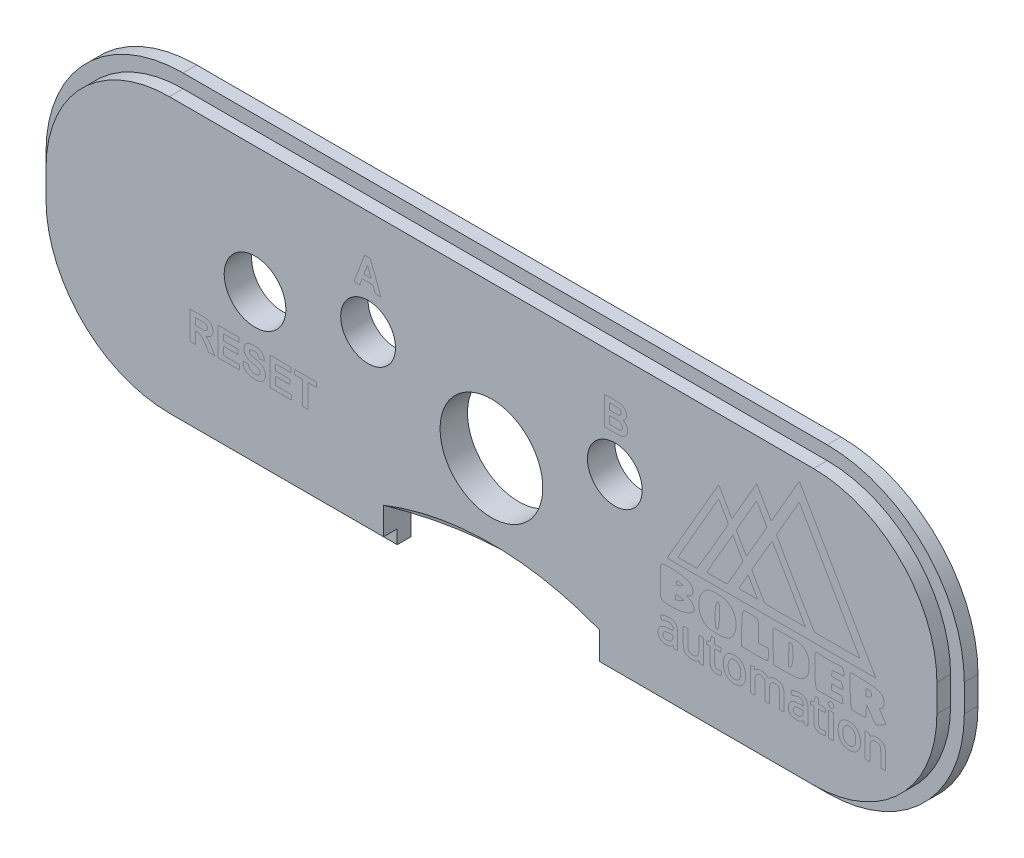
from build123d import *

# Parameters (mm, degrees)
SKETCH1_W           = 67
SKETCH1_H           = 22
BOSS_EXTRUDE1_DEPTH = 1
FILLET1_R           = 10
BOSS_EXTRUDE2_DEPTH = 1
SKETCH3_W           = 15.75
SKETCH3_H           = 6
CUT_EXTRUDE1_DEPTH  = 36.316426773
SKETCH112_R         = 3.75
SKETCH112_R_2       = 2
SKETCH112_R_3       = 2.25
CUT_EXTRUDE2_DEPTH  = 36.316426779


with BuildPart() as part:
    # Sketch1 → Boss-Extrude1 (new body)
    with BuildSketch(Plane.XY):
        Rectangle(SKETCH1_W, SKETCH1_H)
    extrude(amount=BOSS_EXTRUDE1_DEPTH)

    # Fillet1
    fillet1_edges = [part.edges().sort_by_distance(p)[0] for p in [
        (33.5, 11, 0.5),
        (33.5, -11, 0.5),
        (-33.5, -11, 0.5),
        (-33.5, 11, 0.5),
    ]]
    fillet(fillet1_edges, radius=FILLET1_R)

    # Sketch2 → Boss-Extrude2 (add)
    with BuildSketch(Plane.XY.offset(1)):
        with BuildLine():
            Line((32.5, -1), (32.5, 1))
            ThreePointArc((32.5, 1), (29.863961031, 7.363961031), (23.5, 10))
            Line((23.5, 10), (-23.5, 10))
            ThreePointArc((-23.5, 10), (-29.863961031, 7.363961031), (-32.5, 1))
            Line((-32.5, 1), (-32.5, -1))
            ThreePointArc((-32.5, -1), (-29.863961031, -7.363961031), (-23.5, -10))
            Line((-23.5, -10), (23.5, -10))
            ThreePointArc((23.5, -10), (29.863961031, -7.363961031), (32.5, -1))
        make_face()
    extrude(amount=BOSS_EXTRUDE2_DEPTH)

    # Sketch3 → Cut-Extrude1 (cut, through all)
    with BuildSketch(Plane(origin=(0, 0, 0), x_dir=(-1, 0, 0), z_dir=(0, 0, -1))):
        with Locations((0, -11)):
            Rectangle(SKETCH3_W, SKETCH3_H)
    extrude(amount=-CUT_EXTRUDE1_DEPTH, mode=Mode.SUBTRACT)

    # Sketch109 → Cut-Revolve3 (revolve, cut)
    with BuildSketch(Plane.XY.offset(2)):
        with BuildLine():
            ThreePointArc((7.875, -8), (0, -6.5), (-7.875, -8))
            Line((-7.875, -8), (7.875, -8))
        make_face()
    revolve(axis=Axis((7.875, -8, 2), (1, 0, 0)), mode=Mode.SUBTRACT)

    # Sketch112 → Cut-Extrude2 (cut, through all)
    with BuildSketch(Plane(origin=(0, 0, 0), x_dir=(-1, 0, 0), z_dir=(0, 0, -1))):
        with Locations((0, -1.1)):
            Circle(SKETCH112_R)
        with Locations((9, 2.38)):
            Circle(SKETCH112_R_2)
        with Locations((-9, 2.38)):
            Circle(SKETCH112_R_2)
        with Locations((17.25, 0.8)):
            Circle(SKETCH112_R_3)
    extrude(amount=-CUT_EXTRUDE2_DEPTH, mode=Mode.SUBTRACT)


solid = part.part
